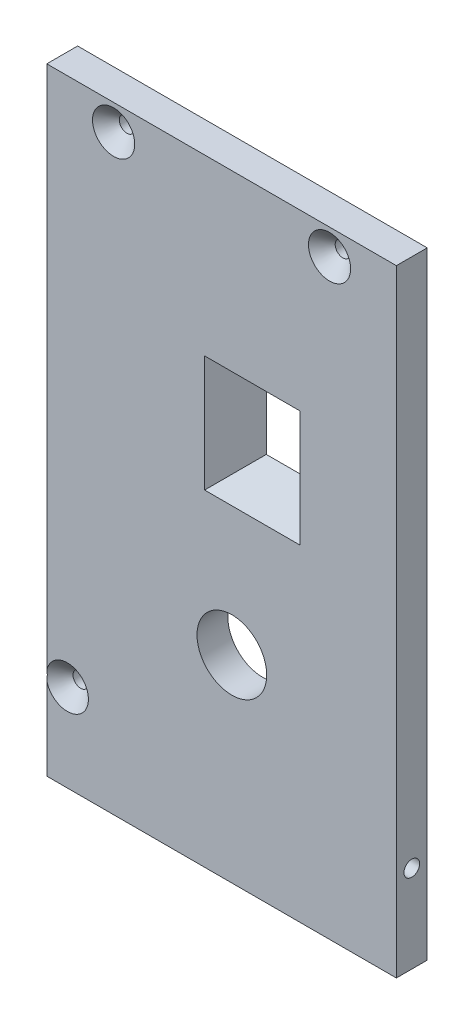
from build123d import *

# Parameters (mm, degrees)
SKETCH1_W           = 34
SKETCH1_H           = 60
SKETCH1_R           = 0.75
BOSS_EXTRUDE1_DEPTH = 3
CHAMFER1_SIZE       = 1.3
SKETCH2_R           = 0.762
CUT_EXTRUDE1_DEPTH  = 7
SKETCH3_W           = 5
SKETCH3_H           = 4.4
CUT_EXTRUDE2_DEPTH  = 1.7
SKETCH4_R           = 0.762
CUT_EXTRUDE3_DEPTH  = 7
SKETCH5_W           = 3.3
SKETCH5_H           = 5.3
CUT_EXTRUDE4_DEPTH  = 3.5
SKETCH7_R           = 0.762
SKETCH7_W           = 7
SKETCH7_H           = 5.3
CUT_EXTRUDE5_DEPTH  = 2.5
SKETCH8_W           = 1.8
SKETCH8_H           = 17.3
CUT_EXTRUDE6_DEPTH  = 2.5
SKETCH9_R           = 3.39
CUT_EXTRUDE7_DEPTH  = 7.5
CHAMFER2_SIZE       = 3


# Some blends are built 0.0001 mm under size
with BuildPart() as part:
    # Sketch1 → Boss-Extrude1 (new body)
    with BuildSketch(Plane.XY):
        Rectangle(SKETCH1_W, SKETCH1_H)
        with Locations((-15, -21.5)):
            Circle(SKETCH1_R, mode=Mode.SUBTRACT)
        with Locations(Location((-10.5, 27.5, 0), (0, 0, 180))):
            Circle(SKETCH1_R, mode=Mode.SUBTRACT)
        with Locations((10.5, 27.5)):
            Circle(SKETCH1_R, mode=Mode.SUBTRACT)
    extrude(amount=BOSS_EXTRUDE1_DEPTH)

    # Chamfer1
    # the kernel refuses this chamfer: 1.3 mm, written as the material it takes off along each edge
    with BuildSketch(Plane(origin=(-15, -21.5, 3), x_dir=(1, 0, 0), z_dir=(0, -1, 0))) as chamfer1_piece_1:
        Polygon((0.75, -CHAMFER1_SIZE), (0.75 + CHAMFER1_SIZE, 0), (0.75, 0), align=None)
    revolve(axis=Axis((-15, -21.5, 3), (0, 0, 1)), mode=Mode.SUBTRACT)
    with BuildSketch(Plane(origin=(-10.5, 27.5, 3), x_dir=(-1, 0, 0), z_dir=(0, 1, 0))) as chamfer1_piece_2:
        Polygon((0.75, -CHAMFER1_SIZE), (0.75 + CHAMFER1_SIZE, 0), (0.75, 0), align=None)
    revolve(axis=Axis((-10.5, 27.5, 3), (0, 0, 1)), mode=Mode.SUBTRACT)
    with BuildSketch(Plane(origin=(10.5, 27.5, 3), x_dir=(1, 0, 0), z_dir=(0, -1, 0))) as chamfer1_piece_3:
        Polygon((0.75, -CHAMFER1_SIZE), (0.75 + CHAMFER1_SIZE, 0), (0.75, 0), align=None)
    revolve(axis=Axis((10.5, 27.5, 3), (0, 0, 1)), mode=Mode.SUBTRACT)

    # Sketch2 → Cut-Extrude1 (cut)
    with BuildSketch(Plane(origin=(17, 0, 0), x_dir=(0, 0, -1), z_dir=(1, 0, 0))):
        with Locations((-1.5, -21.5)):
            Circle(SKETCH2_R)
    extrude(amount=-CUT_EXTRUDE1_DEPTH, mode=Mode.SUBTRACT)

    # Sketch3 → Cut-Extrude2 (cut)
    with BuildSketch(Plane(origin=(0, 0, 0), x_dir=(-1, 0, 0), z_dir=(0, 0, -1))):
        Polygon((3.765333438, -30), (12, -30), (12, -24.8), (7, -24.8), (3.765333438, -24.8), align=None)
        with Locations((9.5, -22.6)):
            Rectangle(SKETCH3_W, SKETCH3_H)
    extrude(amount=-CUT_EXTRUDE2_DEPTH, mode=Mode.SUBTRACT)

    # Sketch4 → Cut-Extrude3 (cut)
    with BuildSketch(Plane.XZ.offset(30)):
        with Locations(Location((15, 1.5, 0), (0, 0, 270))):
            Circle(SKETCH4_R)
    extrude(amount=-CUT_EXTRUDE3_DEPTH, mode=Mode.SUBTRACT)

    # Sketch5 → Cut-Extrude4 (cut)
    with BuildSketch(Plane(origin=(0, 0, 0), x_dir=(-1, 0, 0), z_dir=(0, 0, -1))):
        with Locations((-3, 7.425)):
            Rectangle(SKETCH5_W, SKETCH5_H)
    extrude(amount=-CUT_EXTRUDE4_DEPTH, mode=Mode.SUBTRACT)

    # Sketch7 → Cut-Extrude5 (cut)
    with BuildSketch(Plane(origin=(0, 0, 0), x_dir=(-1, 0, 0), z_dir=(0, 0, -1))):
        with Locations((-13.25, 17.75)):
            Circle(SKETCH7_R)
        with Locations((7.25, 17.75)):
            Circle(SKETCH7_R)
        with Locations(Location((7.25, -2.9, 0), (0, 0, 180))):
            Circle(SKETCH7_R)
        with Locations(Location((-13.25, -2.9, 0), (0, 0, 180))):
            Circle(SKETCH7_R)
        with Locations((-3, 17.2)):
            Rectangle(SKETCH7_W, SKETCH7_H)
        with Locations((-3, -2.35)):
            Rectangle(SKETCH7_W, SKETCH7_H)
    extrude(amount=-CUT_EXTRUDE5_DEPTH, mode=Mode.SUBTRACT)

    # Sketch8 → Cut-Extrude6 (cut)
    with BuildSketch(Plane(origin=(0, 0, 0), x_dir=(-1, 0, 0), z_dir=(0, 0, -1))):
        with Locations((8.8, 7.53)):
            Rectangle(SKETCH8_W, SKETCH8_H)
        with Locations((-14.8, 7.53)):
            Rectangle(SKETCH8_W, SKETCH8_H)
    extrude(amount=-CUT_EXTRUDE6_DEPTH, mode=Mode.SUBTRACT)

    # Sketch9 → Cut-Extrude7 (cut)
    with BuildSketch(Plane(origin=(0, 0, 0), x_dir=(-1, 0, 0), z_dir=(0, 0, -1))):
        with Locations((-1, -10.79)):
            Circle(SKETCH9_R)
    extrude(amount=-CUT_EXTRUDE7_DEPTH, mode=Mode.SUBTRACT)

    # Chamfer2
    chamfer2_edges = [part.edges().sort_by_distance(p)[0] for p in [
        (4.65, 7.425, 3),
        (3, 4.775, 3),
        (1.35, 7.425, 3),
        (3, 10.075, 3),
    ]]
    chamfer(chamfer2_edges, length=CHAMFER2_SIZE - 0.0001)  # a hair under: the kernel refuses the full size


solid = part.part
